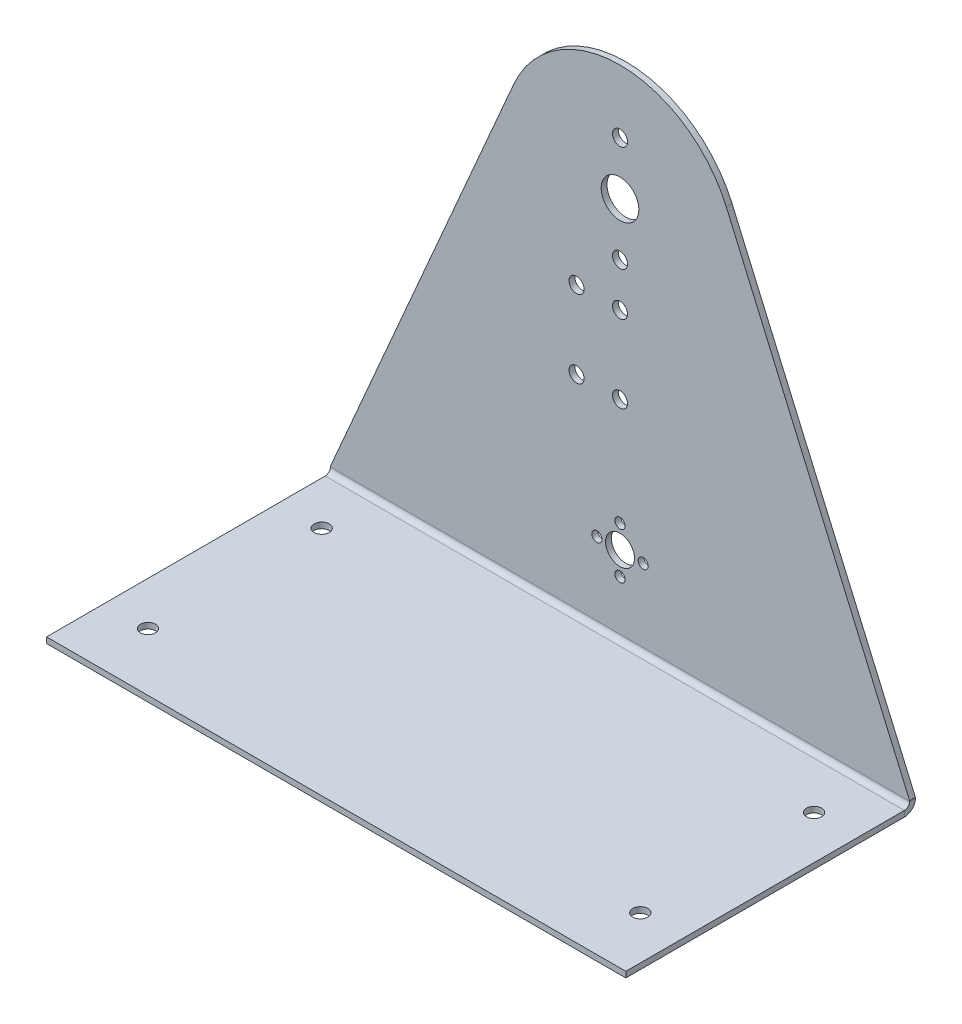
from build123d import *

# Parameters (mm, degrees)
SKETCH1_R            = 6.5
BOSS_EXTRUDE1_DEPTH  = 4
SKETCH4_R            = 2.6
CUT_EXTRUDE1_DEPTH   = 10
SKETCH5_W            = 200
SKETCH5_H            = 4
BOSS_EXTRUDE2_DEPTH  = 100
SKETCH8_R            = 2.6
CUT_EXTRUDE2_DEPTH   = 100
SKETCH9_R            = 5
SKETCH9_R_2          = 1.75
CUT_EXTRUDE3_DEPTH   = 10
CONVERT_SOLID3_START = -100
CONVERT_SOLID3_DEPTH = 200
SKETCH11_R           = 2.6
CUT_EXTRUDE4_DEPTH   = 10


# Read off the part's stored shape, not the designer's step: Convert-Solid3
with BuildPart() as part:
    # Sketch1 → Boss-Extrude1 (new body)
    with BuildSketch(Plane.XY):
        with BuildLine():
            Line((100, -4), (100, 0))
            Line((100, 0), (36.695562583, 145.919663525))
            ThreePointArc((36.695562583, 145.919663525), (0, 170), (-36.695562583, 145.919663525))
            Line((-36.695562583, 145.919663525), (-100, 0))
            Line((-100, 0), (-100, -4))
            Line((-100, -4), (100, -4))
        make_face()
        with Locations((0, 130)):
            Circle(SKETCH1_R, mode=Mode.SUBTRACT)
    extrude(amount=BOSS_EXTRUDE1_DEPTH)

    # Sketch4 → Cut-Extrude1 (cut)
    with BuildSketch(Plane(origin=(0, 0, 0), x_dir=(-1, 0, 0), z_dir=(0, 0, -1))):
        with Locations((0, 111.75)):
            Circle(SKETCH4_R)
        with Locations((0, 148.25)):
            Circle(SKETCH4_R)
    extrude(amount=-CUT_EXTRUDE1_DEPTH, mode=Mode.SUBTRACT)

    # Sketch5 → Boss-Extrude2 (add)
    with BuildSketch(Plane(origin=(0, 0, 0), x_dir=(-1, 0, 0), z_dir=(0, 0, -1))):
        with Locations((0, -2)):
            Rectangle(SKETCH5_W, SKETCH5_H)
    extrude(amount=-BOSS_EXTRUDE2_DEPTH)

    # Sketch8 → Cut-Extrude2 (cut)
    with BuildSketch(Plane(origin=(0, 0, 0), x_dir=(1, 0, 0), z_dir=(0, 1, 0))):
        with Locations(Location((-85, -80, 0), (0, 0, 270))):
            Circle(SKETCH8_R)
        with Locations(Location((-85, -20, 0), (0, 0, 270))):
            Circle(SKETCH8_R)
        with Locations(Location((85, -80, 0), (0, 0, 270))):
            Circle(SKETCH8_R)
        with Locations(Location((85, -20, 0), (0, 0, 270))):
            Circle(SKETCH8_R)
    extrude(amount=-CUT_EXTRUDE2_DEPTH, mode=Mode.SUBTRACT)

    # Sketch9 → Cut-Extrude3 (cut)
    with BuildSketch(Plane.XY.offset(4)):
        with Locations((0, 25)):
            Circle(SKETCH9_R)
        with Locations((0, 33)):
            Circle(SKETCH9_R_2)
        with Locations((0, 17)):
            Circle(SKETCH9_R_2)
        with Locations((8, 25)):
            Circle(SKETCH9_R_2)
        with Locations((-8, 25)):
            Circle(SKETCH9_R_2)
    extrude(amount=-CUT_EXTRUDE3_DEPTH, mode=Mode.SUBTRACT)

    # Convert-Solid3 outline → Convert-Solid3 (cut)
    with BuildSketch(Plane.YZ.offset(CONVERT_SOLID3_START)):
        with BuildLine():
            ThreePointArc((-0.2, 0), (-2.887005769, 1.112994231), (-4, 3.8))
            Line((-4, 3.8), (-3.999999957, 100))
            Line((-3.999999957, 100), (-6, 100))
            Line((-6, 100), (-6, -1))
            Line((-6, -1), (171, -1))
            Line((171, -1), (171, 7.6e-08))
            Line((171, 7.6e-08), (-0.2, 0))
        make_face()
        with BuildLine():
            Line((0, 100), (-2, 100))
            Line((-2, 100), (-2, 3.8))
            ThreePointArc((-2, 3.8), (-1.472792206, 2.527207794), (-0.2, 2))
            Line((-0.2, 2), (171, 2))
            Line((171, 2), (171, 4))
            Line((171, 4), (0, 4))
            Line((0, 4), (0, 100))
        make_face()
    extrude(amount=CONVERT_SOLID3_DEPTH, mode=Mode.SUBTRACT)

    # Sketch11 → Cut-Extrude4 (cut)
    with BuildSketch(Plane.XY.offset(2)):
        with Locations((0, 70)):
            Circle(SKETCH11_R)
        with Locations((0, 96.75)):
            Circle(SKETCH11_R)
        with Locations((-15, 96.75)):
            Circle(SKETCH11_R)
        with Locations((-15, 70)):
            Circle(SKETCH11_R)
    extrude(amount=-CUT_EXTRUDE4_DEPTH, mode=Mode.SUBTRACT)


solid = part.part
